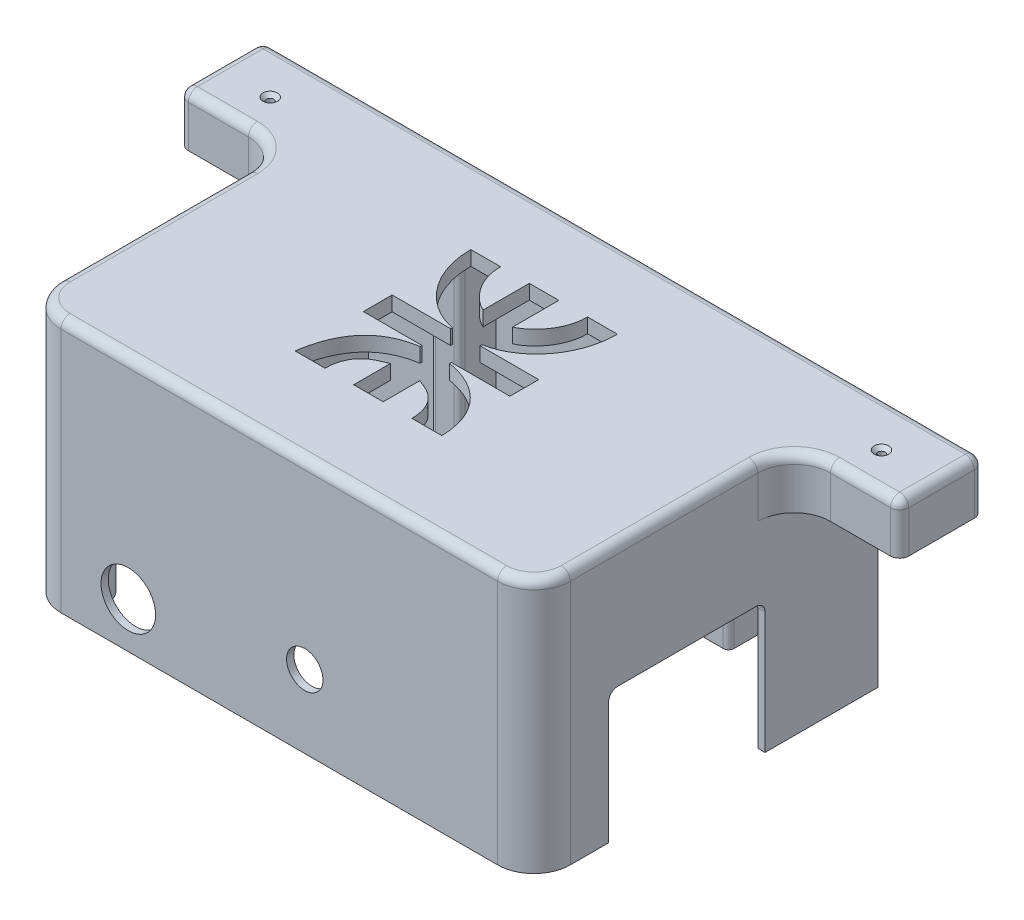
from build123d import *

# Parameters (mm, degrees)
SALIENTE_EXTRUIR1_DEPTH = 70
CORTAR_EXTRUIR1_START   = -70
CROQUIS2_W              = 29
CROQUIS2_H              = 23
CORTAR_EXTRUIR1_DEPTH   = 56
CROQUIS3_W              = 136
CROQUIS3_H              = 90.5
CORTAR_EXTRUIR2_DEPTH   = 66
REDONDEO5_R             = 10
REDONDEO13_R            = 2.5
REDONDEO14_R            = 10
REDONDEO15_R            = 10
CROQUIS7_W              = 15
CROQUIS7_H              = 13
CORTAR_EXTRUIR4_DEPTH   = 2
CROQUIS8_W              = 43
CROQUIS8_H              = 36
CORTAR_EXTRUIR5_DEPTH   = 140
CROQUIS9_R              = 7.5
CROQUIS9_R_2            = 5
CORTAR_EXTRUIR6_DEPTH   = 2
CROQUIS10_R             = 1
SALIENTE_EXTRUIR8_DEPTH = 66
CROQUIS10_4_R           = 1
CORTAR_EXTRUIR7_DEPTH   = 10
REDONDEO18_R            = 5
CROQUIS12_W             = 8.003042052
CROQUIS12_H             = 10
CROQUIS12_R             = 1
SALIENTE_EXTRUIR9_DEPTH = 66
CROQUIS12_3_R           = 1
CORTAR_EXTRUIR8_DEPTH   = 10
REDONDEO19_R            = 1.5
CORTAR_EXTRUIR9_REACH   = 136.7
CROQUIS13_R             = 1
REDONDEO20_R            = 2.5
CHAFL_N1_SIZE           = 1
CORTAR_EXTRUIR10_REACH  = 136.7
REDONDEO21_R            = 2.5


with BuildPart() as part:
    # Croquis1 → Saliente-Extruir1 (new body)
    with BuildSketch(Plane(origin=(0, 0, 0), x_dir=(1, 0, 0), z_dir=(0, 1, 0))):
        Polygon((-70, -35.821234201), (70, -35.821234201), (70, 35.678765799), (99, 35.678765799), (99, 58.678765799), (-99, 58.678765799), (-99, 35.678765799), (-70, 35.678765799), align=None)
    extrude(amount=SALIENTE_EXTRUIR1_DEPTH)

    # Croquis2 → Cortar-Extruir1 (cut)
    with BuildSketch(Plane(origin=(0, 70, 0), x_dir=(1, 0, 0), z_dir=(0, 1, 0)).offset(CORTAR_EXTRUIR1_START)):
        with Locations((-84.5, 47.178765799)):
            Rectangle(CROQUIS2_W, CROQUIS2_H)
        with Locations((84.5, 47.178765799)):
            Rectangle(CROQUIS2_W, CROQUIS2_H)
    extrude(amount=CORTAR_EXTRUIR1_DEPTH, mode=Mode.SUBTRACT)

    # Croquis3 → Cortar-Extruir2 (cut)
    with BuildSketch(Plane.XZ):
        with Locations((0, -11.428765799)):
            Rectangle(CROQUIS3_W, CROQUIS3_H)
    extrude(amount=-CORTAR_EXTRUIR2_DEPTH, mode=Mode.SUBTRACT)

    # Redondeo5
    redondeo5_edges = [part.edges().sort_by_distance(p)[0] for p in [
        (-70, 63, -35.678765799),
        (70, 63, -35.678765799),
    ]]
    fillet(redondeo5_edges, radius=REDONDEO5_R)

    # Redondeo13
    redondeo13_edges = [part.edges().sort_by_distance(p)[0] for p in [
        (-99, 63, -35.678765799),
        (-99, 63, -58.678765799),
        (99, 63, -58.678765799),
        (99, 63, -35.678765799),
    ]]
    fillet(redondeo13_edges, radius=REDONDEO13_R)

    # Redondeo14
    redondeo14_edges = [part.edges().sort_by_distance(p)[0] for p in [
        (-68, 33, 33.821234201),
        (68, 33, 33.821234201),
    ]]
    fillet(redondeo14_edges, radius=REDONDEO14_R)

    # Redondeo15
    redondeo15_edges = [part.edges().sort_by_distance(p)[0] for p in [
        (70, 35, 35.821234201),
        (-70, 35, 35.821234201),
    ]]
    fillet(redondeo15_edges, radius=REDONDEO15_R)

    # Croquis7 → Cortar-Extruir4 (cut)
    with BuildSketch(Plane(origin=(0, 0, -58.678765799), x_dir=(-1, 0, 0), z_dir=(0, 0, -1))):
        with Locations((0, 6.5)):
            Rectangle(CROQUIS7_W, CROQUIS7_H)
    extrude(amount=-CORTAR_EXTRUIR4_DEPTH, mode=Mode.SUBTRACT)

    # Croquis8 → Cortar-Extruir5 (cut)
    with BuildSketch(Plane.ZY.offset(70)):
        with Locations((-6.178765799, 18)):
            Rectangle(CROQUIS8_W, CROQUIS8_H)
    extrude(amount=-CORTAR_EXTRUIR5_DEPTH, mode=Mode.SUBTRACT)

    # Croquis9 → Cortar-Extruir6 (cut)
    with BuildSketch(Plane.XY.offset(35.821234201)):
        with Locations((-41.5, 12.5)):
            Circle(CROQUIS9_R)
        with Locations((7, 20)):
            Circle(CROQUIS9_R_2)
    extrude(amount=-CORTAR_EXTRUIR6_DEPTH, mode=Mode.SUBTRACT)


with BuildPart() as saliente_extruir8_tool:
    # Croquis10 → Saliente-Extruir8 (new body)
    # profile 1 of 4: a face of its own
    with BuildSketch(Plane(origin=(0, 0, 0), x_dir=(1, 0, 0), z_dir=(0, 1, 0))):
        with BuildLine():
            ThreePointArc((-56, -33.821234201), (-65.071066479, -30.89230068), (-68, -21.821234201))
            Line((-68, -21.821234201), (-56, -21.821234201))
            Line((-56, -21.821234201), (-56, -33.821234201))
        make_face()
        with Locations((-62, -27.821234201)):
            Circle(CROQUIS10_R, mode=Mode.SUBTRACT)
    # profile 2 of 4: a face of its own
    with BuildSketch(Plane(origin=(0, 0, 0), x_dir=(1, 0, 0), z_dir=(0, 1, 0))):
        with Locations((-62, -27.821234201)):
            Circle(CROQUIS10_R)
    # profile 3 of 4: a face of its own
    with BuildSketch(Plane(origin=(0, 0, 0), x_dir=(1, 0, 0), z_dir=(0, 1, 0))):
        with BuildLine():
            Line((56, -33.821234201), (56, -21.821234201))
            Line((56, -21.821234201), (68, -21.821234201))
            ThreePointArc((68, -21.821234201), (65.071066479, -30.89230068), (56, -33.821234201))
        make_face()
        with Locations((62, -27.821234201)):
            Circle(CROQUIS10_R, mode=Mode.SUBTRACT)
    # profile 4 of 4: a face of its own
    with BuildSketch(Plane(origin=(0, 0, 0), x_dir=(1, 0, 0), z_dir=(0, 1, 0))):
        with Locations((62, -27.821234201)):
            Circle(CROQUIS10_R)
    extrude(amount=SALIENTE_EXTRUIR8_DEPTH)


with BuildPart() as part_1:
    add(part.part)


with BuildPart() as part_2:
    # Saliente-Extruir8: joined with saliente_extruir8_tool
    add(part_1.part.fuse(saliente_extruir8_tool.part, tol=0.00001))

    # Croquis10<4> → Cortar-Extruir7 (cut)
    with BuildSketch(Plane(origin=(0, 0, 0), x_dir=(1, 0, 0), z_dir=(0, 1, 0))):
        with Locations(Location((-62, -27.821234201, 0), (0, 0, 270))):
            Circle(CROQUIS10_4_R)
        with Locations(Location((62, -27.821234201, 0), (0, 0, 90))):
            Circle(CROQUIS10_4_R)
    extrude(amount=CORTAR_EXTRUIR7_DEPTH, mode=Mode.SUBTRACT)

    # Redondeo18
    redondeo18_edges = [part_2.edges().sort_by_distance(p)[0] for p in [
        (-56, 33, 21.821234201),
        (56, 33, 21.821234201),
    ]]
    fillet(redondeo18_edges, radius=REDONDEO18_R)

    # Croquis12 → Saliente-Extruir9 (add)
    # profile 1 of 4: a face of its own
    with BuildSketch(Plane(origin=(0, 0, 0), x_dir=(1, 0, 0), z_dir=(0, 1, 0))):
        with Locations((-36.998478974, 51.678765799)):
            Rectangle(CROQUIS12_W, CROQUIS12_H)
        with Locations((-37, 50.678765799)):
            Circle(CROQUIS12_R, mode=Mode.SUBTRACT)
    # profile 2 of 4: a face of its own
    with BuildSketch(Plane(origin=(0, 0, 0), x_dir=(1, 0, 0), z_dir=(0, 1, 0))):
        with Locations((-37, 50.678765799)):
            Circle(CROQUIS12_R)
    # profile 3 of 4: a face of its own
    with BuildSketch(Plane(origin=(0, 0, 0), x_dir=(1, 0, 0), z_dir=(0, 1, 0))):
        with Locations((36.998478974, 51.678765799)):
            Rectangle(CROQUIS12_W, CROQUIS12_H)
        with Locations((37, 50.678765799)):
            Circle(CROQUIS12_R, mode=Mode.SUBTRACT)
    # profile 4 of 4: a face of its own
    with BuildSketch(Plane(origin=(0, 0, 0), x_dir=(1, 0, 0), z_dir=(0, 1, 0))):
        with Locations((37, 50.678765799)):
            Circle(CROQUIS12_R)
    extrude(amount=SALIENTE_EXTRUIR9_DEPTH)

    # Croquis12<3> → Cortar-Extruir8 (cut)
    with BuildSketch(Plane(origin=(0, 0, 0), x_dir=(1, 0, 0), z_dir=(0, 1, 0))):
        with Locations(Location((-37, 50.678765799, 0), (0, 0, 270))):
            Circle(CROQUIS12_3_R)
        with Locations(Location((37, 50.678765799, 0), (0, 0, 90))):
            Circle(CROQUIS12_3_R)
    extrude(amount=CORTAR_EXTRUIR8_DEPTH, mode=Mode.SUBTRACT)

    # Redondeo19
    redondeo19_edges = [part_2.edges().sort_by_distance(p)[0] for p in [
        (-41, 33, -46.678765799),
        (-32.996957948, 33, -46.678765799),
        (41, 33, -46.678765799),
        (32.996957948, 33, -46.678765799),
    ]]
    fillet(redondeo19_edges, radius=REDONDEO19_R)

    # Croquis13 → Cortar-Extruir9 (cut, up to next)
    with BuildSketch(Plane(origin=(0, 70, 0), x_dir=(1, 0, 0), z_dir=(0, 1, 0)), mode=Mode.PRIVATE) as cortar_extruir9_sk1:
        with Locations(Location((-84, 45.678765799, 0), (0, 0, 270))):
            Circle(CROQUIS13_R)
    cortar_extruir9_tool1 = extrude(cortar_extruir9_sk1.sketch, amount=-CORTAR_EXTRUIR9_REACH, mode=Mode.PRIVATE) & part_2.part
    # Croquis13 → Cortar-Extruir9 (cut, up to next)
    with BuildSketch(Plane(origin=(0, 70, 0), x_dir=(1, 0, 0), z_dir=(0, 1, 0)), mode=Mode.PRIVATE) as cortar_extruir9_sk2:
        with Locations(Location((84, 45.678765799, 0), (0, 0, 270))):
            Circle(CROQUIS13_R)
    cortar_extruir9_tool2 = extrude(cortar_extruir9_sk2.sketch, amount=-CORTAR_EXTRUIR9_REACH, mode=Mode.PRIVATE) & part_2.part
    add(cortar_extruir9_tool1.solids().sort_by_distance((-84, 70, -45.678766))[0], mode=Mode.SUBTRACT)
    add(cortar_extruir9_tool2.solids().sort_by_distance((84, 70, -45.678766))[0], mode=Mode.SUBTRACT)

    # Redondeo20
    redondeo20_edges = [part_2.edges().sort_by_distance(p)[0] for p in [
        (70, 70, 0.071234201),
        (0, 70, 35.821234201),
        (-67.071067812, 70, 32.892302013),
        (67.071067812, 70, 32.892302013),
        (88.25, 70, -35.678765799),
        (-70, 70, 0.071234201),
        (72.928932188, 70, -32.749833611),
        (-72.928932188, 70, -32.749833611),
        (99, 70, -47.178765799),
        (-88.25, 70, -35.678765799),
        (0, 70, -58.678765799),
        (-99, 70, -47.178765799),
        (-98.267766953, 70, -36.410998846),
        (-98.267766953, 70, -57.946532752),
        (98.267766953, 70, -57.946532752),
        (98.267766953, 70, -36.410998846),
    ]]
    fillet(redondeo20_edges, radius=REDONDEO20_R)

    # Chaflán1
    chafl_n1_edges = [part_2.edges().sort_by_distance(p)[0] for p in [
        (-84, 70, -46.678765799),
        (84, 70, -46.678765799),
    ]]
    chamfer(chafl_n1_edges, length=CHAFL_N1_SIZE)

    # Croquis14 → Cortar-Extruir10 (cut, up to next)
    with BuildSketch(Plane(origin=(0, 70, 0), x_dir=(1, 0, 0), z_dir=(0, 1, 0)), mode=Mode.PRIVATE) as cortar_extruir10_sk1:
        with BuildLine():
            Line((-20.146838321, 36.956484824), (-11.95073101, 36.956484824))
            add(Edge.make_bspline(
                [(-4.057227177, 24.289864733), (-6.695826358, 25.256300103), (-12.074790019, 30.099684352), (-11.95073101, 36.956484824)],
                knots=[0, 0, 0, 0, 1, 1, 1, 1], degree=3))
            Line((-4.057227177, 24.289864733), (-4.057227177, 36.956484824))
            Line((-4.057227177, 36.956484824), (-0.004461878, 36.956484824))
            Line((-0.004461878, 36.956484824), (4.048303421, 36.956484824))
            Line((4.048303421, 36.956484824), (4.048303421, 24.289864733))
            add(Edge.make_bspline(
                [(4.048303421, 24.289864733), (6.686902602, 25.256300103), (12.065866263, 30.099684352), (11.941807254, 36.956484824)],
                knots=[0, 0, 0, 0, 1, 1, 1, 1], degree=3))
            Line((11.941807254, 36.956484824), (20.137914565, 36.956484824))
            add(Edge.make_bspline(
                [(20.137914565, 36.956484824), (20.18966101, 25.923210578), (12.570913778, 17.333037065), (4.048303421, 15.858130647)],
                knots=[0, 0, 0, 0, 1, 1, 1, 1], degree=3))
            Line((4.048303421, 15.858130647), (4.048303421, 15.340241278))
            Line((4.048303421, 15.340241278), (20.137914565, 15.340241278))
            Line((20.137914565, 15.340241278), (20.137914565, 7.422481759))
            Line((20.137914565, 7.422481759), (4.048303421, 7.422481759))
            Line((4.048303421, 7.422481759), (4.048303421, 6.913890274))
            add(Edge.make_bspline(
                [(4.048303421, 6.913890274), (13.268768878, 5.474688597), (20.063360811, -0.98235836), (20.137914565, -11.315515176)],
                knots=[0, 0, 0, 0, 1, 1, 1, 1], degree=3))
            Line((20.137914565, -11.315515176), (12.224292823, -11.315515176))
            Line((12.224292823, -11.315515176), (11.941807254, -11.315515176))
            add(Edge.make_bspline(
                [(4.05214205, -1.257632017), (5.359686174, -1.943634241), (11.876845008, -3.072276016), (11.941807254, -11.315515176)],
                knots=[0, 0, 0, 0, 1, 1, 1, 1], degree=3))
            Line((4.05214205, -1.257632017), (4.05214205, -11.315515176))
            Line((4.05214205, -11.315515176), (-4.061065806, -11.315515176))
            Line((-4.061065806, -11.315515176), (-4.061065806, -1.257632017))
            add(Edge.make_bspline(
                [(-4.061065806, -1.257632017), (-5.36860993, -1.943634241), (-11.885768764, -3.072276016), (-11.95073101, -11.315515176)],
                knots=[0, 0, 0, 0, 1, 1, 1, 1], degree=3))
            Line((-11.95073101, -11.315515176), (-12.233216579, -11.315515176))
            Line((-12.233216579, -11.315515176), (-20.146838321, -11.315515176))
            add(Edge.make_bspline(
                [(-4.057227177, 6.913890274), (-17.887925363, 4.755087759), (-20.146838321, -11.315515176)],
                knots=[0, 0, 0, 1, 1, 1], degree=2))
            Line((-4.057227177, 6.913890274), (-4.057227177, 7.422481759))
            Line((-4.057227177, 7.422481759), (-20.146838321, 7.422481759))
            Line((-20.146838321, 7.422481759), (-20.146838321, 15.340241278))
            Line((-20.146838321, 15.340241278), (-4.057227177, 15.340241278))
            Line((-4.057227177, 15.340241278), (-4.057227177, 15.858130647))
            add(Edge.make_bspline(
                [(-20.146838321, 36.956484824), (-20.198584766, 25.923210578), (-12.579837534, 17.333037065), (-4.057227177, 15.858130647)],
                knots=[0, 0, 0, 0, 1, 1, 1, 1], degree=3))
        make_face()
    cortar_extruir10_tool1 = extrude(cortar_extruir10_sk1.sketch, amount=-CORTAR_EXTRUIR10_REACH, mode=Mode.PRIVATE) & part_2.part
    add(cortar_extruir10_tool1.solids().sort_by_distance((0.076213, 70, -12.699632))[0], mode=Mode.SUBTRACT)

    # Redondeo21
    redondeo21_edges = [part_2.edges().sort_by_distance(p)[0] for p in [
        (-69, 36, -27.678765799),
        (69, 36, -27.678765799),
        (-69, 36, 15.321234201),
        (69, 36, 15.321234201),
    ]]
    fillet(redondeo21_edges, radius=REDONDEO21_R)


solid = part_2.part
